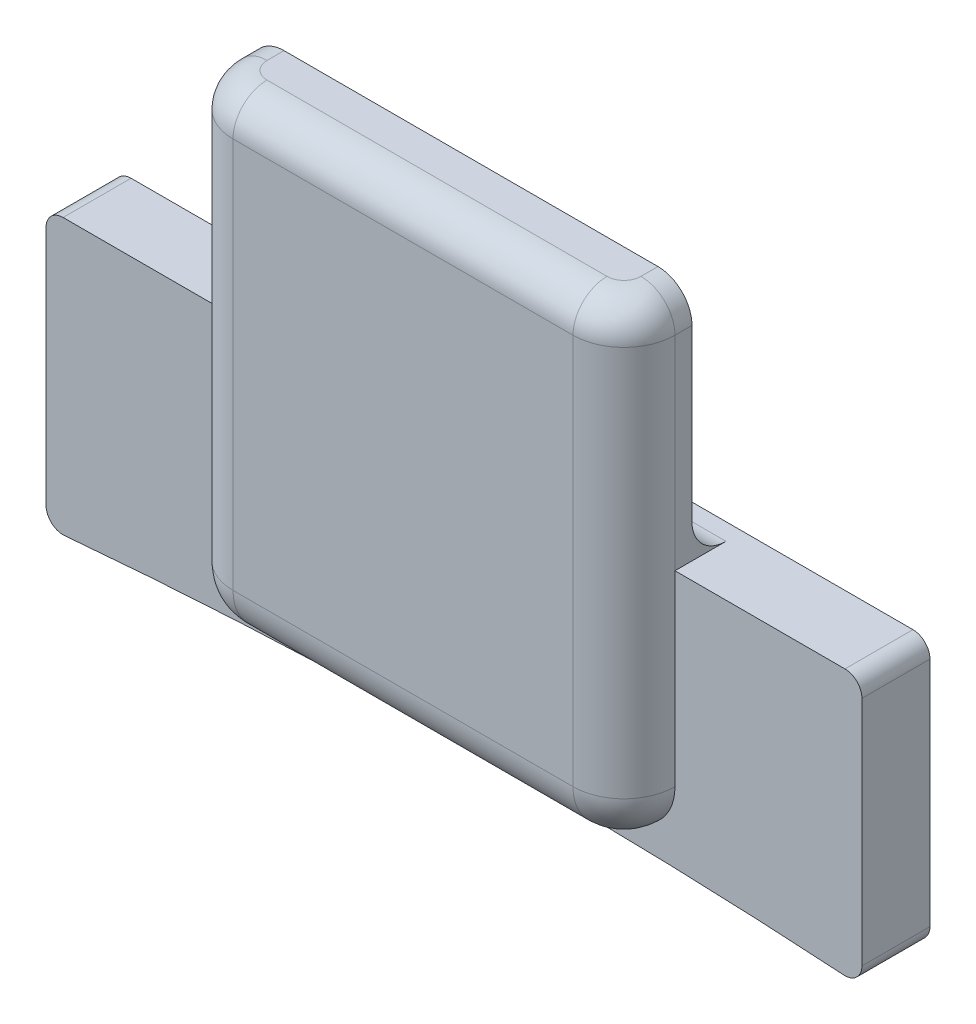
from build123d import *

# Parameters (mm, degrees)
BOSS_EXTRUDE1_DEPTH = 4
SKETCH4_W           = 26
SKETCH4_H           = 14
BOSS_EXTRUDE2_DEPTH = 3
FILLET1_R           = 1
FILLET3_R           = 3
FILLET4_R           = 3
BOSS_EXTRUDE9_DEPTH = 14
FILLET5_R           = 2
FILLET6_R           = 2


# Some blends are built 0.0001 mm under size
with BuildPart() as part:
    # Sketch1 → Boss-Extrude1 (new body)
    with BuildSketch(Plane(origin=(0, 0, 0), x_dir=(-1, 0, 0), z_dir=(0, 0, -1))):
        with BuildLine():
            Line((27.500000074, -16.263075607), (27.500000074, 0))
            Line((27.500000074, 0), (-20.499999926, 0))
            Line((-20.499999926, 0), (-20.499999926, -15.701236215))
            ThreePointArc((-20.499999926, -15.701236215), (3.511255672, -15.020548898), (27.500000074, -16.263075607))
        make_face()
    extrude(amount=-BOSS_EXTRUDE1_DEPTH)

    # Sketch4 → Boss-Extrude2 (add)
    with BuildSketch(Plane.XY.offset(4)):
        with Locations((-3.500000074, -7)):
            Rectangle(SKETCH4_W, SKETCH4_H)
    extrude(amount=BOSS_EXTRUDE2_DEPTH)

    # Fillet1
    fillet1_edges = [part.edges().sort_by_distance(p)[0] for p in [
        (20.499999926, 0, 2),
        (-27.500000074, 0, 2),
        (20.499999926, -15.701236215, 2),
        (-27.500000074, -16.263075607, 2),
    ]]
    fillet(fillet1_edges, radius=FILLET1_R)

    # Fillet3
    fillet3_edges = [part.edges().sort_by_distance(p)[0] for p in [
        (-3.500000074, -14, 7),
        (-16.500000074, -7, 7),
        (9.499999926, -7, 7),
    ]]
    fillet(fillet3_edges, radius=FILLET3_R - 0.0001)  # a hair under: the kernel refuses the full size

    # Fillet4
    # the kernel refuses this fillet: 3 mm, written as the material it takes off along each edge
    with BuildSketch(Plane(origin=(-13.500000074, -11, 7), x_dir=(-1, 0, 0), z_dir=(0, 1, 0))) as fillet4_piece_1:
        with BuildLine():
            CenterArc((0.0001, -2.9999), 2.9999, 0, 90)
            Line((3, -2.9999), (3, 0))
            Line((3, 0), (0.0001, 0))
        make_face()
    revolve(axis=Axis((-13.500000074, -11, 7), (0, 0, 1)), revolution_arc=90, mode=Mode.SUBTRACT)
    with BuildSketch(Plane(origin=(6.499999926, -11, 7), x_dir=(0, -1, 0), z_dir=(-1, 0, 0))) as fillet4_piece_2:
        with BuildLine():
            CenterArc((0.0001, -2.9999), 2.9999, 0, 90)
            Line((3, -2.9999), (3, 0))
            Line((3, 0), (0.0001, 0))
        make_face()
    revolve(axis=Axis((6.499999926, -11, 7), (0, 0, 1)), revolution_arc=90, mode=Mode.SUBTRACT)
    with BuildSketch(Plane(origin=(9.499999926, -14, 4), x_dir=(0, 1, 0), z_dir=(0, 0, 1))) as fillet4_piece_3:
        with BuildLine():
            CenterArc((FILLET4_R, FILLET4_R), FILLET4_R, 180, 90)
            Line((0, FILLET4_R), (0, 0))
            Line((0, 0), (FILLET4_R, 0))
        make_face()
    extrude(amount=3, mode=Mode.SUBTRACT)
    with BuildSketch(Plane(origin=(-16.500000074, -14, 4), x_dir=(0, 1, 0), z_dir=(0, 0, 1))) as fillet4_piece_4:
        with BuildLine():
            CenterArc((FILLET4_R, -FILLET4_R), FILLET4_R, 90, 90)
            Line((0, -FILLET4_R), (0, 0))
            Line((0, 0), (FILLET4_R, 0))
        make_face()
    extrude(amount=3, mode=Mode.SUBTRACT)

    # Sketch21 → Boss-Extrude9 (add)
    with BuildSketch(Plane(origin=(0, 0, 0), x_dir=(1, 0, 0), z_dir=(0, 1, 0))):
        with BuildLine():
            Line((6.499999926, -7), (-13.500000074, -7))
            ThreePointArc((-13.500000074, -7), (-15.621320417, -6.121320344), (-16.500000074, -4))
            Line((-16.500000074, -4), (-16.500000074, -3))
            Line((-16.500000074, -3), (9.499999926, -3))
            Line((9.499999926, -3), (9.499999926, -4))
            ThreePointArc((9.499999926, -4), (8.62132027, -6.121320344), (6.499999926, -7))
        make_face()
    extrude(amount=BOSS_EXTRUDE9_DEPTH)

    # Fillet5
    fillet5_edges = [part.edges().sort_by_distance(p)[0] for p in [
        (-16.500000074, 14, 3.5),
        (-15.621320417, 14, 6.121320344),
        (9.499999926, 14, 3.5),
        (8.62132027, 14, 6.121320344),
        (-3.500000074, 14, 7),
    ]]
    fillet(fillet5_edges, radius=FILLET5_R)

    # Fillet6
    fillet6_edges = [part.edges().sort_by_distance(p)[0] for p in [
        (-3.500000074, 0, 3),
    ]]
    fillet(fillet6_edges, radius=FILLET6_R)


solid = part.part
